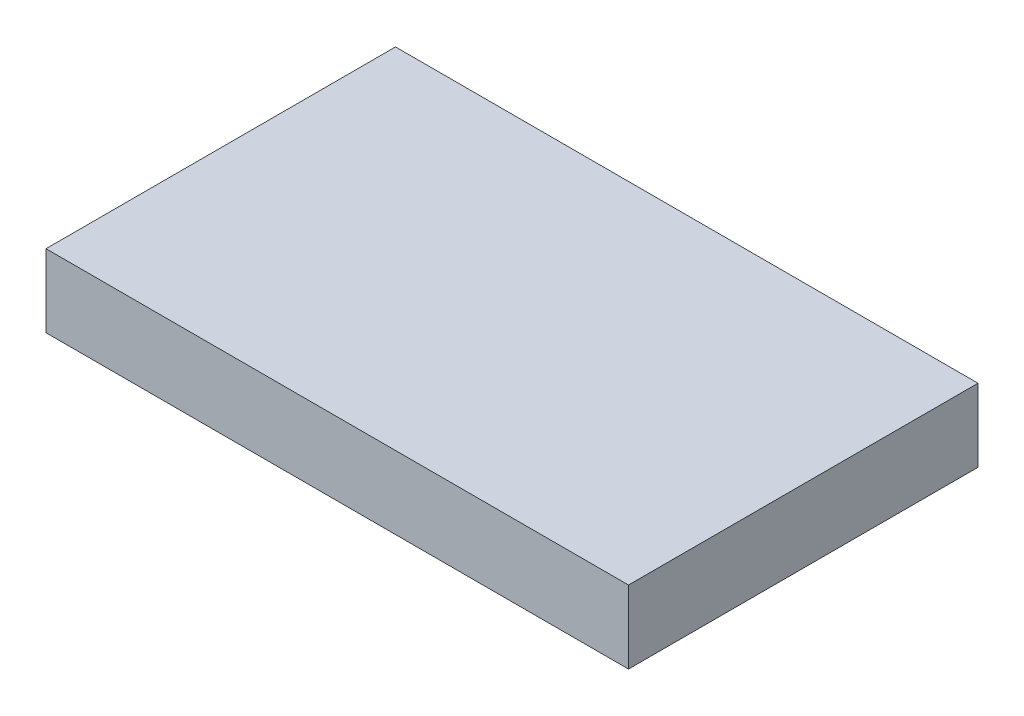
from build123d import *

# Parameters (mm, degrees)
SKETCH1_W           = 50.8
SKETCH1_H           = 30.48
BOSS_EXTRUDE1_DEPTH = 3.175


with BuildPart() as part:
    # Sketch1 → Boss-Extrude1 (new, symmetric)
    with BuildSketch(Plane(origin=(0, 0, 0), x_dir=(1, 0, 0), z_dir=(0, 1, 0))):
        Rectangle(SKETCH1_W, SKETCH1_H)
    extrude(amount=BOSS_EXTRUDE1_DEPTH, both=True)


solid = part.part
